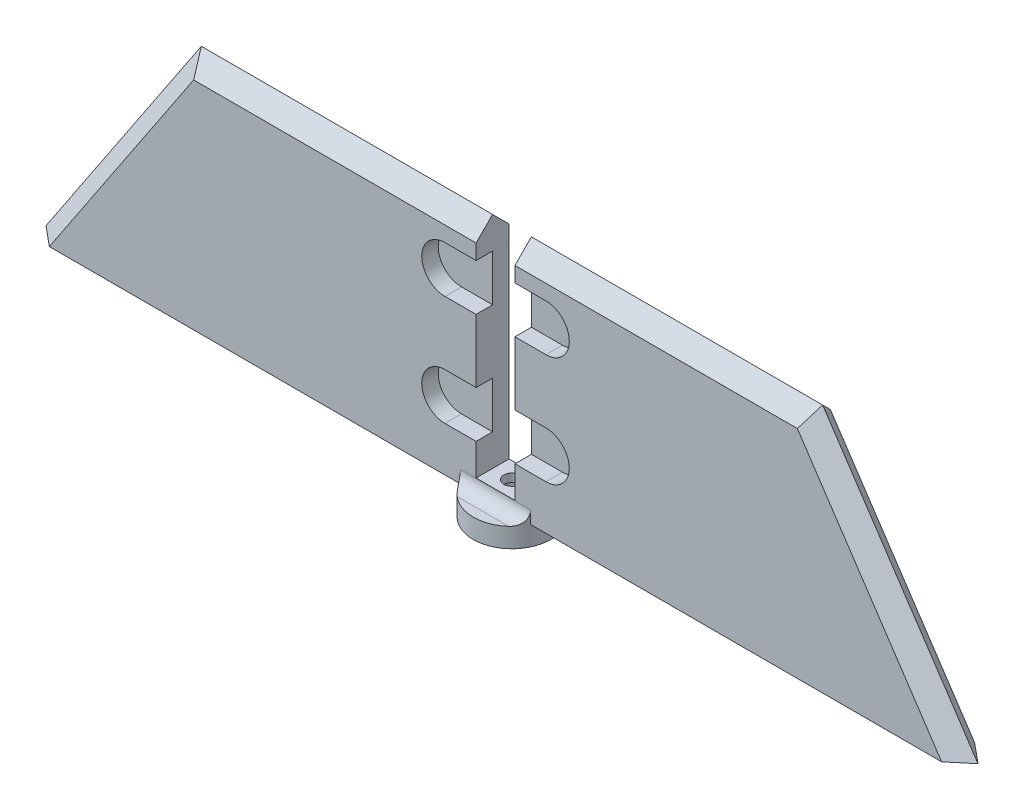
from build123d import *

# Parameters (mm, degrees)
SALIENTE_EXTRUIR1_DEPTH = 2.125
CROQUIS2_R              = 5
SALIENTE_EXTRUIR2_DEPTH = 2.5
REDONDEO1_R             = 1.625
SKETCH1_R               = 2.45
CUT_EXTRUDE1_DEPTH      = 3.1
CHAMFER1_SIZE           = 2.125
CUT_EXTRUDE2_DEPTH      = 68.459362768
CUT_EXTRUDE2_DEPTH_BACK = 68.459362768
SKETCH2_W               = 5
SKETCH2_H               = 28.351341624
CUT_EXTRUDE3_DEPTH      = 68.002686513
CUT_EXTRUDE3_DEPTH_BACK = 68.002686513
SKETCH3_R               = 1.05
CUT_EXTRUDE4_DEPTH      = 68.459362768
CUT_EXTRUDE4_DEPTH_BACK = 2.125


# Some blends are built 0.0001 mm under size
with BuildPart() as part:
    # Croquis1 → Saliente-Extruir1 (new, symmetric)
    with BuildSketch(Plane.XY):
        Polygon((60, 0), (-60, 0), (-40, 30), (40, 30), align=None)
    extrude(amount=SALIENTE_EXTRUIR1_DEPTH, both=True)

    # Croquis2 → Saliente-Extruir2 (add)
    with BuildSketch(Plane.XZ):
        with Locations(Location((0, 0, 0), (0, 0, 25.150663413))):
            Circle(CROQUIS2_R)
    extrude(amount=SALIENTE_EXTRUIR2_DEPTH)

    # Redondeo1
    # the kernel refuses this fillet: 1.625 mm, written as the material it adds along each edge
    with BuildSketch(Plane(origin=(8.588466748, 0, -2.125), x_dir=(0, 1, 0), z_dir=(-1, 0, 0))) as redondeo1_piece_1_section:
        with BuildLine():
            CenterArc((REDONDEO1_R, REDONDEO1_R), REDONDEO1_R, 180, 90)
            Line((0, REDONDEO1_R), (0, 0))
            Line((0, 0), (REDONDEO1_R, 0))
        make_face()
    redondeo1_piece_1 = extrude(amount=17.176933495, mode=Mode.PRIVATE)
    redondeo1_piece_1 = redondeo1_piece_1 & Plane(origin=(0, 0.370660795, 0), x_dir=(0.9051933495081991, 0, 0.4250000000072087), z_dir=(0, 1, 0)) * Cylinder(5, 41, mode=Mode.PRIVATE)
    add(redondeo1_piece_1)
    with BuildSketch(Plane(origin=(8.588466748, 0, 2.125), x_dir=(0, 1, 0), z_dir=(-1, 0, 0))) as redondeo1_piece_2_section:
        with BuildLine():
            CenterArc((REDONDEO1_R, -REDONDEO1_R), REDONDEO1_R, 90, 90)
            Line((0, -REDONDEO1_R), (0, 0))
            Line((0, 0), (REDONDEO1_R, 0))
        make_face()
    redondeo1_piece_2 = extrude(amount=17.176933495, mode=Mode.PRIVATE)
    redondeo1_piece_2 = redondeo1_piece_2 & Plane(origin=(0, 0.370660827, 0), x_dir=(0.9051933495081991, 0, 0.4250000000072087), z_dir=(0, 1, 0)) * Cylinder(5, 41, mode=Mode.PRIVATE)
    add(redondeo1_piece_2)

    # Sketch1 → Cut-Extrude1 (cut)
    with BuildSketch(Plane.XZ.offset(2.5)):
        with Locations(Location((0, 0, 0), (0, 0, 270))):
            Circle(SKETCH1_R)
    extrude(amount=-CUT_EXTRUDE1_DEPTH, mode=Mode.SUBTRACT)

    # Chamfer1
    chamfer1_edges = [part.edges().sort_by_distance(p)[0] for p in [
        (50, 15, -2.125),
        (0, 30, -2.125),
        (-50, 15, -2.125),
        (50, 15, 2.125),
        (0, 30, 2.125),
        (-50, 15, 2.125),
    ]]
    chamfer(chamfer1_edges, length=CHAMFER1_SIZE - 0.0001)  # a hair under: the kernel refuses the full size

    # Sketch2 → Cut-Extrude2 (cut, two sides: drawn at the far end of the back side and taken through both)
    with BuildSketch(Plane.XY.offset(2.125).offset(-CUT_EXTRUDE2_DEPTH_BACK)):
        with Locations((0, 15.85)):
            Rectangle(SKETCH2_W, SKETCH2_H)
    extrude(amount=CUT_EXTRUDE2_DEPTH + CUT_EXTRUDE2_DEPTH_BACK, mode=Mode.SUBTRACT)

    # Sketch3 → Cut-Extrude3 (cut, two sides: drawn at the far end of the back side and taken through both)
    with BuildSketch(Plane.XZ.offset(-0.6).offset(-CUT_EXTRUDE3_DEPTH_BACK)):
        with Locations(Location((0, 0, 0), (0, 0, 270))):
            Circle(SKETCH3_R)
    extrude(amount=CUT_EXTRUDE3_DEPTH + CUT_EXTRUDE3_DEPTH_BACK, mode=Mode.SUBTRACT)

    # Sketch4 → Cut-Extrude4 (cut, two sides: drawn at the far end of the back side and taken through both)
    with BuildSketch(Plane.XY.offset(2.125).offset(-CUT_EXTRUDE4_DEPTH_BACK)):
        with BuildLine():
            Line((2.5, 25.918582297), (2.5, 19.918582297))
            Line((2.5, 19.918582297), (6.5, 19.918582297))
            ThreePointArc((6.5, 19.918582297), (9.5, 22.918582297), (6.5, 25.918582297))
            Line((6.5, 25.918582297), (2.5, 25.918582297))
        make_face()
        with BuildLine():
            Line((6.5, 11.755746891), (2.5, 11.755746891))
            Line((2.5, 11.755746891), (2.5, 5.755746891))
            Line((2.5, 5.755746891), (6.5, 5.755746891))
            ThreePointArc((6.5, 5.755746891), (9.5, 8.755746891), (6.5, 11.755746891))
        make_face()
        with BuildLine():
            Line((-6.5, 19.918582297), (-2.5, 19.918582297))
            Line((-2.5, 19.918582297), (-2.5, 25.918582297))
            Line((-2.5, 25.918582297), (-6.5, 25.918582297))
            ThreePointArc((-6.5, 25.918582297), (-9.5, 22.918582297), (-6.5, 19.918582297))
        make_face()
        with BuildLine():
            Line((-2.5, 5.755746891), (-2.5, 11.755746891))
            Line((-2.5, 11.755746891), (-6.5, 11.755746891))
            ThreePointArc((-6.5, 11.755746891), (-9.5, 8.755746891), (-6.5, 5.755746891))
            Line((-6.5, 5.755746891), (-2.5, 5.755746891))
        make_face()
    extrude(amount=CUT_EXTRUDE4_DEPTH + CUT_EXTRUDE4_DEPTH_BACK, mode=Mode.SUBTRACT)


solid = part.part
